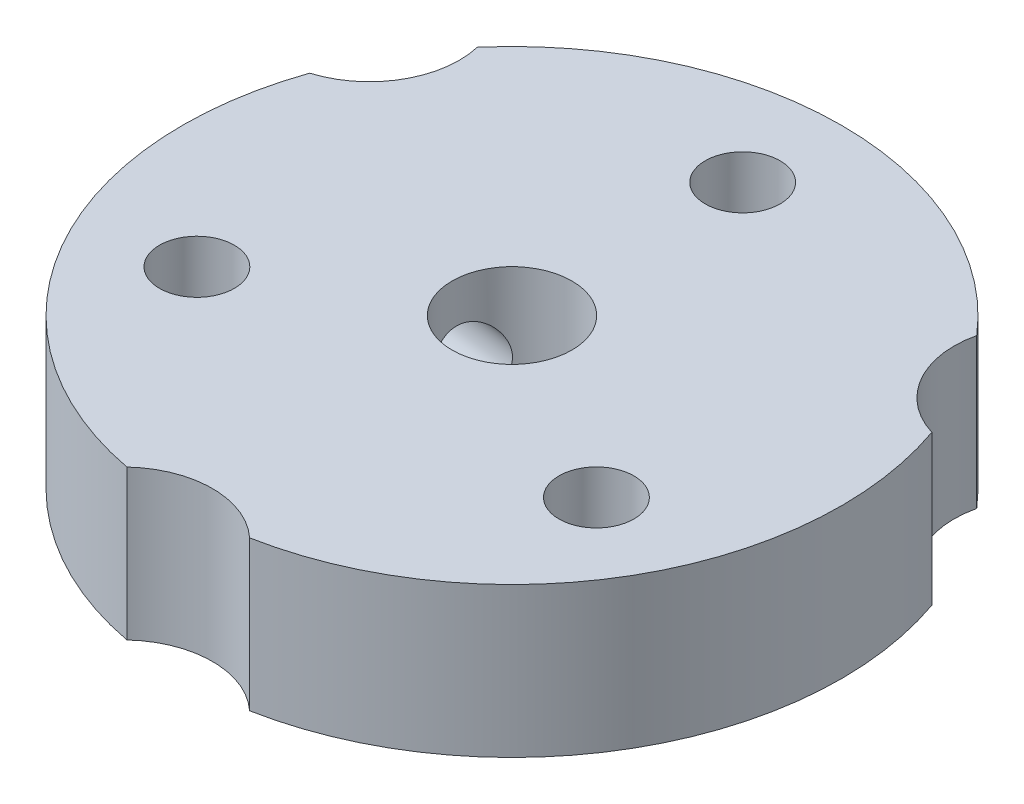
from build123d import *

# Parameters (mm, degrees)
ESBO_O1_R                = 11
RESSALTO_EXTRUS_O1_DEPTH = 5
ESBO_O3_R                = 1.25
CORTE_EXTRUS_O1_DEPTH    = 10.095971114
ESBO_O22_R               = 3
CORTE_EXTRUS_O6_DEPTH    = 5.5
ESBO_O23_R               = 3
CORTE_EXTRUS_O7_DEPTH    = 1.5
ESBO_O27_R               = 2
CORTE_EXTRUS_O8_DEPTH    = 10


# Read off the part's stored shape, not the designer's step: Broca de rosquear para tarraxa de M3x0.52
with BuildPart() as part:
    # Esboço1 → Ressalto-extrusão1 (new body)
    with BuildSketch(Plane(origin=(0, 0, 0), x_dir=(1, 0, 0), z_dir=(0, 1, 0))):
        with Locations(Location((0, 0, 0), (0, 0, 270))):
            Circle(ESBO_O1_R)
    extrude(amount=RESSALTO_EXTRUS_O1_DEPTH)

    # Esboço3 → Corte-extrusão1 (cut)
    with BuildSketch(Plane(origin=(0, 5, 0), x_dir=(1, 0, 0), z_dir=(0, 1, 0))):
        with Locations(Location((0, 7.7, 0), (0, 0, 270))):
            Circle(ESBO_O3_R)
        with Locations(Location((6.668395609, -3.85, 0), (0, 0, 270))):
            Circle(ESBO_O3_R)
        with Locations(Location((-6.668395609, -3.85, 0), (0, 0, 270))):
            Circle(ESBO_O3_R)
    extrude(amount=-CORTE_EXTRUS_O1_DEPTH, mode=Mode.SUBTRACT)

    # Esboço22 → Corte-extrusão6 (cut)
    with BuildSketch(Plane(origin=(0, 5, 0), x_dir=(1, 0, 0), z_dir=(0, 1, 0))):
        with Locations((-11.258330249, 6.5)):
            Circle(ESBO_O22_R)
        with Locations((0, -13)):
            Circle(ESBO_O22_R)
        with Locations((11.258330249, 6.5)):
            Circle(ESBO_O22_R)
    extrude(amount=-CORTE_EXTRUS_O6_DEPTH, mode=Mode.SUBTRACT)

    # Esboço23 → Corte-extrusão7 (cut)
    with BuildSketch(Plane(origin=(0, 0, 0), x_dir=(-1, 0, 0), z_dir=(0, -1, 0))):
        with Locations(Location((-6.668395609, -3.85, 0), (0, 0, 90))):
            Circle(ESBO_O23_R)
        with Locations(Location((6.668395609, -3.85, 0), (0, 0, 90))):
            Circle(ESBO_O23_R)
        with Locations(Location((0, 7.7, 0), (0, 0, 90))):
            Circle(ESBO_O23_R)
    extrude(amount=-CORTE_EXTRUS_O7_DEPTH, mode=Mode.SUBTRACT)

    # Esboço27 → Corte-extrusão8 (cut)
    with BuildSketch(Plane.XZ):
        with Locations(Location((0, 0, 0), (0, 0, 270))):
            Circle(ESBO_O27_R)
    extrude(amount=-CORTE_EXTRUS_O8_DEPTH, mode=Mode.SUBTRACT)

    # Broca de rosquear para tarraxa de M3 2 → Broca de rosquear para tarraxa de M3x0.52 (revolve, cut)
    with BuildSketch(Plane(origin=(0, 2.382860609, 0), x_dir=(0, 1, 0), z_dir=(0.11587924714300103, 0, -0.9932633085348372))):
        Polygon((0, -11.00002072), (1.275019909, -11.000019909), (1.249997575, -10.974997575), (1.25, -1.561025492), (0, -1.561025492), align=None)
    revolve(axis=Axis((0, 2.382860609, 0), (0.9932633085348372, 0, 0.11587924714300103)), mode=Mode.SUBTRACT)


solid = part.part
